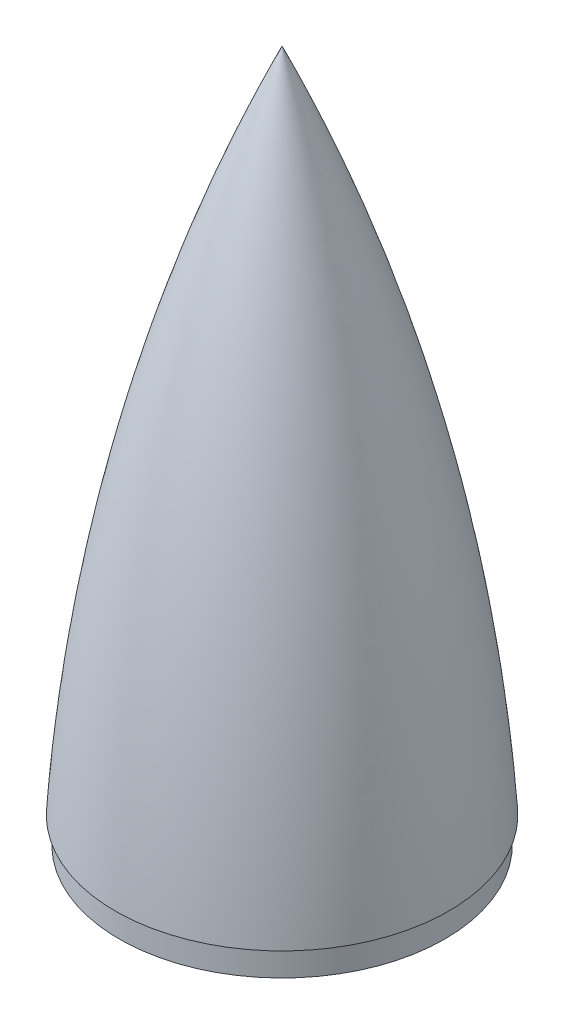
from build123d import *

# Parameters (mm, degrees)
SKETCH4_R           = 93.1545
SKETCH4_R_2         = 89.027
BOSS_EXTRUDE2_DEPTH = 15


with BuildPart() as part:
    # Sketch2 → Revolve1 (revolve)
    with BuildSketch(Plane.XY):
        with BuildLine():
            Line((-95.4151, 0), (-90.3351, 0))
            ThreePointArc((-90.3351, 0), (-60.321108147, 191.601461456), (0, 375.92))
            Line((0, 375.92), (0, 381))
            ThreePointArc((0, 381), (-64.956040942, 194.819597082), (-95.4151, 0))
        make_face()
    revolve(axis=Axis((0, 381, 0), (0, -1, 0)))

    # Sketch4 → Boss-Extrude2 (add)
    with BuildSketch(Plane(origin=(0, 0, 0), x_dir=(-1, 0, 0), z_dir=(0, -1, 0))):
        Circle(SKETCH4_R)
        Circle(SKETCH4_R_2, mode=Mode.SUBTRACT)
    extrude(amount=BOSS_EXTRUDE2_DEPTH)


solid = part.part
